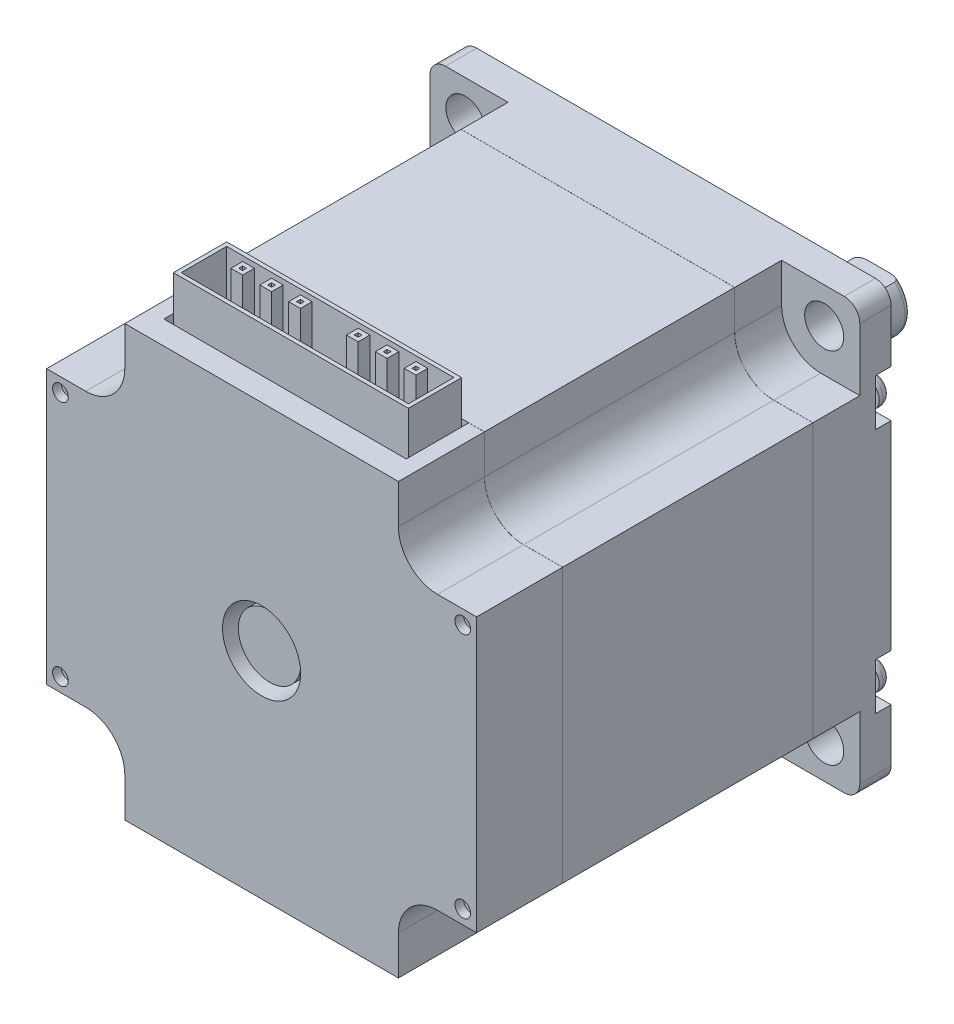
from build123d import *

# Parameters (mm, degrees)
SKETCH_1_R              = 5
SKETCH_1_R_2            = 2.5
EXTRUDE_1_DEPTH         = 4
SKETCH_2_R              = 5
EXTRUDE_2_DEPTH         = 6
SKETCH_3_R              = 5
EXTRUDE_3_DEPTH         = 32
SKETCH_4_R              = 5
EXTRUDE_4_DEPTH         = 11
EXTRUDE_5_DEPTH         = 52
EXTRUDE_5_DEPTH_BACK    = 26
SKETCH_5_R              = 4
SKETCH_6_W              = 13.056631504
SKETCH_6_H              = 3.959548569
CUT_EXTRUDE_1_DEPTH     = 18
EXTRUDE_START           = 1
SKETCH_7_R              = 19
SKETCH_7_R_2            = 5
EXTRUDE_6_DEPTH         = 1
SKETCH_8_W              = 31
SKETCH_8_H              = 8
CUT_EXTRUDE_2_DEPTH     = 5
SKETCH_9_W              = 30.064308904
SKETCH_9_H              = 6.814167658
SKETCH_9_W_2            = 29.064308904
SKETCH_9_H_2            = 5.814167658
SKETCH_9_W_3            = 1.5
SKETCH_9_H_3            = 1.5
SKETCH_9_W_4            = 0.5
SKETCH_9_H_4            = 0.5
EXTRUDE_1_2_DEPTH       = 10
SKETCH_10_R             = 1
CUT_EXTRUDE_3_DEPTH     = 60
CUT_EXTRUDE_START       = -2
SKETCH_11_R             = 1
CUT_EXTRUDE_4_DEPTH     = 2
EXTRUDE_7_DEPTH         = 0.5
EXTRUDE_7_DEPTH_BACK    = 50
SKETCH_12_R             = 0.9
EXTRUDE_7_2_DEPTH       = 0.5
EXTRUDE_7_2_DEPTH_BACK  = 50
EXTRUDE_7_3_DEPTH       = 0.5
EXTRUDE_7_3_DEPTH_BACK  = 50
EXTRUDE_7_4_DEPTH       = 0.5
EXTRUDE_7_4_DEPTH_BACK  = 50
SKETCH_13_R             = 1.75
EXTRUDE_8_DEPTH         = 1.5
FILLET_2_R              = 1
FILLET_3_R              = 1
FILLET_4_R              = 1
FILLET_5_R              = 1
CUT_EXTRUDE_START_2     = -1
CUT_EXTRUDE_1_2_DEPTH   = 1
CUT_EXTRUDE_1_2_2_DEPTH = 1
CUT_EXTRUDE_1_2_3_DEPTH = 1
CUT_EXTRUDE_1_2_4_DEPTH = 1


with BuildPart() as part:
    # Эскиз1 → Extrude 1 (new body)
    # profile 1 of 6: a face of its own
    with BuildSketch(Plane.XY):
        with BuildLine():
            ThreePointArc((-17.5, -22.5), (-18.964466094, -18.964466094), (-22.5, -17.5))
            Line((-22.5, -17.5), (-27.5, -17.5))
            Line((-27.5, -17.5), (-27.5, 17.5))
            Line((-27.5, 17.5), (-22.5, 17.5))
            ThreePointArc((-22.5, 17.5), (-18.964466094, 18.964466094), (-17.5, 22.5))
            Line((-17.5, 22.5), (-17.5, 27.5))
            Line((-17.5, 27.5), (17.5, 27.5))
            Line((17.5, 27.5), (17.5, 22.5))
            ThreePointArc((17.5, 22.5), (18.964466094, 18.964466094), (22.5, 17.5))
            Line((22.5, 17.5), (27.5, 17.5))
            Line((27.5, 17.5), (27.5, -17.5))
            Line((27.5, -17.5), (22.5, -17.5))
            ThreePointArc((22.5, -17.5), (18.964466094, -18.964466094), (17.5, -22.5))
            Line((17.5, -22.5), (17.5, -27.5))
            Line((17.5, -27.5), (-17.5, -27.5))
            Line((-17.5, -27.5), (-17.5, -22.5))
        make_face()
        Circle(SKETCH_1_R, mode=Mode.SUBTRACT)
    # profile 2 of 6: a face of its own
    with BuildSketch(Plane.XY):
        with BuildLine():
            Line((17.5, 22.5), (17.5, 27.5))
            Line((17.5, 27.5), (25.5, 27.5))
            ThreePointArc((25.5, 27.5), (26.914213562, 26.914213562), (27.5, 25.5))
            Line((27.5, 25.5), (27.5, 17.5))
            Line((27.5, 17.5), (22.5, 17.5))
            ThreePointArc((22.5, 17.5), (18.964466094, 18.964466094), (17.5, 22.5))
        make_face()
        with Locations((22.946359788, 22.946359788)):
            Circle(SKETCH_1_R_2, mode=Mode.SUBTRACT)
    # profile 3 of 6: a face of its own
    with BuildSketch(Plane.XY):
        with BuildLine():
            ThreePointArc((-25.5, 27.5), (-26.265366865, 27.347759065), (-26.914213562, 26.914213562))
            Line((-26.914213562, 26.914213562), (-24.714126741, 24.714126741))
            ThreePointArc((-24.714126741, 24.714126741), (-21.989651207, 25.256058619), (-20.446359788, 22.946359788))
            ThreePointArc((-20.446359788, 22.946359788), (-20.636660957, 21.989651207), (-21.178592835, 21.178592835))
            Line((-21.178592835, 21.178592835), (-18.964466094, 18.964466094))
            ThreePointArc((-18.964466094, 18.964466094), (-17.880602337, 20.586582838), (-17.5, 22.5))
            Line((-17.5, 22.5), (-17.5, 27.5))
            Line((-17.5, 27.5), (-25.5, 27.5))
        make_face()
    # profile 4 of 6: a face of its own
    with BuildSketch(Plane.XY):
        with BuildLine():
            ThreePointArc((-26.914213562, 26.914213562), (-27.347759065, 26.265366865), (-27.5, 25.5))
            Line((-27.5, 25.5), (-27.5, 17.5))
            Line((-27.5, 17.5), (-22.5, 17.5))
            ThreePointArc((-22.5, 17.5), (-20.586582838, 17.880602337), (-18.964466094, 18.964466094))
            Line((-18.964466094, 18.964466094), (-21.178592835, 21.178592835))
            ThreePointArc((-21.178592835, 21.178592835), (-24.714126741, 21.178592835), (-24.714126741, 24.714126741))
            Line((-24.714126741, 24.714126741), (-26.914213562, 26.914213562))
        make_face()
    # profile 5 of 6: a face of its own
    with BuildSketch(Plane.XY):
        with BuildLine():
            Line((-17.5, -22.5), (-17.5, -27.5))
            Line((-17.5, -27.5), (-25.5, -27.5))
            ThreePointArc((-25.5, -27.5), (-26.914213562, -26.914213562), (-27.5, -25.5))
            Line((-27.5, -25.5), (-27.5, -17.5))
            Line((-27.5, -17.5), (-22.5, -17.5))
            ThreePointArc((-22.5, -17.5), (-18.964466094, -18.964466094), (-17.5, -22.5))
        make_face()
        with Locations((-22.946359788, -22.946359788)):
            Circle(SKETCH_1_R_2, mode=Mode.SUBTRACT)
    # profile 6 of 6: a face of its own
    with BuildSketch(Plane.XY):
        with BuildLine():
            ThreePointArc((17.5, -22.5), (18.964466094, -18.964466094), (22.5, -17.5))
            Line((22.5, -17.5), (27.5, -17.5))
            Line((27.5, -17.5), (27.5, -25.5))
            ThreePointArc((27.5, -25.5), (26.914213562, -26.914213562), (25.5, -27.5))
            Line((25.5, -27.5), (17.5, -27.5))
            Line((17.5, -27.5), (17.5, -22.5))
        make_face()
        with Locations((22.946359788, -22.946359788)):
            Circle(SKETCH_1_R_2, mode=Mode.SUBTRACT)
    extrude(amount=EXTRUDE_1_DEPTH)

    # Эскиз2 → Бобышка-Вытянуть2 (add)
    with BuildSketch(Plane.XY.offset(4)):
        with BuildLine():
            ThreePointArc((-17.5, -22.5), (-18.964466094, -18.964466094), (-22.5, -17.5))
            Line((-22.5, -17.5), (-27.5, -17.5))
            Line((-27.5, -17.5), (-27.5, 17.5))
            Line((-27.5, 17.5), (-22.5, 17.5))
            ThreePointArc((-22.5, 17.5), (-18.964466094, 18.964466094), (-17.5, 22.5))
            Line((-17.5, 22.5), (-17.5, 27.5))
            Line((-17.5, 27.5), (17.5, 27.5))
            Line((17.5, 27.5), (17.5, 22.5))
            ThreePointArc((17.5, 22.5), (18.964466094, 18.964466094), (22.5, 17.5))
            Line((22.5, 17.5), (27.5, 17.5))
            Line((27.5, 17.5), (27.5, -17.5))
            Line((27.5, -17.5), (22.5, -17.5))
            ThreePointArc((22.5, -17.5), (18.964466094, -18.964466094), (17.5, -22.5))
            Line((17.5, -22.5), (17.5, -27.5))
            Line((17.5, -27.5), (-17.5, -27.5))
            Line((-17.5, -27.5), (-17.5, -22.5))
        make_face()
        Circle(SKETCH_2_R, mode=Mode.SUBTRACT)
    extrude(amount=EXTRUDE_2_DEPTH)

    # Эскиз7 → Бобышка-Вытянуть6 (add)
    with BuildSketch(Plane(origin=(0, 0, 0), x_dir=(-1, 0, 0), z_dir=(0, 0, -1)).offset(EXTRUDE_START)):
        with Locations(Location((0, 0, 0), (0, 0, 180))):
            Circle(SKETCH_7_R)
        with Locations(Location((0, 0, 0), (0, 0, 180))):
            Circle(SKETCH_7_R_2, mode=Mode.SUBTRACT)
    extrude(amount=-EXTRUDE_6_DEPTH)


with BuildPart() as body_2:
    # Эскиз3 → Бобышка-Вытянуть3 (new body)
    with BuildSketch(Plane.XY.offset(10.01)):
        with BuildLine():
            ThreePointArc((-17.5, -22.5), (-18.964466094, -18.964466094), (-22.5, -17.5))
            Line((-22.5, -17.5), (-27.5, -17.5))
            Line((-27.5, -17.5), (-27.5, 17.5))
            Line((-27.5, 17.5), (-22.5, 17.5))
            ThreePointArc((-22.5, 17.5), (-18.964466094, 18.964466094), (-17.5, 22.5))
            Line((-17.5, 22.5), (-17.5, 27.5))
            Line((-17.5, 27.5), (17.5, 27.5))
            Line((17.5, 27.5), (17.5, 22.5))
            ThreePointArc((17.5, 22.5), (18.964466094, 18.964466094), (22.5, 17.5))
            Line((22.5, 17.5), (27.5, 17.5))
            Line((27.5, 17.5), (27.5, -17.5))
            Line((27.5, -17.5), (22.5, -17.5))
            ThreePointArc((22.5, -17.5), (18.964466094, -18.964466094), (17.5, -22.5))
            Line((17.5, -22.5), (17.5, -27.5))
            Line((17.5, -27.5), (-17.5, -27.5))
            Line((-17.5, -27.5), (-17.5, -22.5))
        make_face()
        Circle(SKETCH_3_R, mode=Mode.SUBTRACT)
    extrude(amount=EXTRUDE_3_DEPTH)


with BuildPart() as body_3:
    # Эскиз4 → Бобышка-Вытянуть4 (new body)
    with BuildSketch(Plane.XY.offset(42.02)):
        with BuildLine():
            ThreePointArc((-17.5, -22.5), (-18.964466094, -18.964466094), (-22.5, -17.5))
            Line((-22.5, -17.5), (-27.5, -17.5))
            Line((-27.5, -17.5), (-27.5, 17.5))
            Line((-27.5, 17.5), (-22.5, 17.5))
            ThreePointArc((-22.5, 17.5), (-18.964466094, 18.964466094), (-17.5, 22.5))
            Line((-17.5, 22.5), (-17.5, 27.5))
            Line((-17.5, 27.5), (17.5, 27.5))
            Line((17.5, 27.5), (17.5, 22.5))
            ThreePointArc((17.5, 22.5), (18.964466094, 18.964466094), (22.5, 17.5))
            Line((22.5, 17.5), (27.5, 17.5))
            Line((27.5, 17.5), (27.5, -17.5))
            Line((27.5, -17.5), (22.5, -17.5))
            ThreePointArc((22.5, -17.5), (18.964466094, -18.964466094), (17.5, -22.5))
            Line((17.5, -22.5), (17.5, -27.5))
            Line((17.5, -27.5), (-17.5, -27.5))
            Line((-17.5, -27.5), (-17.5, -22.5))
        make_face()
        Circle(SKETCH_4_R, mode=Mode.SUBTRACT)
    extrude(amount=EXTRUDE_4_DEPTH)

    # Эскиз8 → Вырез-Вытянуть2 (cut)
    with BuildSketch(Plane(origin=(0, 27.5, 0), x_dir=(1, 0, 0), z_dir=(0, 1, 0))):
        with Locations((0, -46.02)):
            Rectangle(SKETCH_8_W, SKETCH_8_H)
    extrude(amount=-CUT_EXTRUDE_2_DEPTH, mode=Mode.SUBTRACT)

    # Эскиз9 → Extrude 1 2 (add)
    # profile 1 of 7: a face of its own
    with BuildSketch(Plane(origin=(0, 22.5, 0), x_dir=(1, 0, 0), z_dir=(0, 1, 0))):
        with Locations((0, -45.862916171)):
            Rectangle(SKETCH_9_W, SKETCH_9_H)
        with Locations((0, -45.862916171)):
            Rectangle(SKETCH_9_W_2, SKETCH_9_H_2, mode=Mode.SUBTRACT)
    # profile 2 of 7: a face of its own
    with BuildSketch(Plane(origin=(0, 22.5, 0), x_dir=(1, 0, 0), z_dir=(0, 1, 0))):
        with Locations((3.695538613, -44.360416171)):
            Rectangle(SKETCH_9_W_3, SKETCH_9_H_3)
        with Locations((3.695538613, -44.360416171)):
            Rectangle(SKETCH_9_W_4, SKETCH_9_H_4, mode=Mode.SUBTRACT)
    # profile 3 of 7: a face of its own
    with BuildSketch(Plane(origin=(0, 22.5, 0), x_dir=(1, 0, 0), z_dir=(0, 1, 0))):
        with Locations((7.391077226, -44.360416171)):
            Rectangle(SKETCH_9_W_3, SKETCH_9_H_3)
        with Locations((7.391077226, -44.360416171)):
            Rectangle(SKETCH_9_W_4, SKETCH_9_H_4, mode=Mode.SUBTRACT)
    # profile 4 of 7: a face of its own
    with BuildSketch(Plane(origin=(0, 22.5, 0), x_dir=(1, 0, 0), z_dir=(0, 1, 0))):
        with Locations((-3.695538613, -44.360416171)):
            Rectangle(SKETCH_9_W_3, SKETCH_9_H_3)
        with Locations((-3.695538613, -44.360416171)):
            Rectangle(SKETCH_9_W_4, SKETCH_9_H_4, mode=Mode.SUBTRACT)
    # profile 5 of 7: a face of its own
    with BuildSketch(Plane(origin=(0, 22.5, 0), x_dir=(1, 0, 0), z_dir=(0, 1, 0))):
        with Locations((-11.086615839, -44.360416171)):
            Rectangle(SKETCH_9_W_3, SKETCH_9_H_3)
        with Locations((-11.086615839, -44.360416171)):
            Rectangle(SKETCH_9_W_4, SKETCH_9_H_4, mode=Mode.SUBTRACT)
    # profile 6 of 7: a face of its own
    with BuildSketch(Plane(origin=(0, 22.5, 0), x_dir=(1, 0, 0), z_dir=(0, 1, 0))):
        with Locations((11.086615839, -44.360416171)):
            Rectangle(SKETCH_9_W_3, SKETCH_9_H_3)
        with Locations((11.086615839, -44.360416171)):
            Rectangle(SKETCH_9_W_4, SKETCH_9_H_4, mode=Mode.SUBTRACT)
    # profile 7 of 7: a face of its own
    with BuildSketch(Plane(origin=(0, 22.5, 0), x_dir=(1, 0, 0), z_dir=(0, 1, 0))):
        with Locations((-7.391077226, -44.360416171)):
            Rectangle(SKETCH_9_W_3, SKETCH_9_H_3)
        with Locations((-7.391077226, -44.360416171)):
            Rectangle(SKETCH_9_W_4, SKETCH_9_H_4, mode=Mode.SUBTRACT)
    extrude(amount=EXTRUDE_1_2_DEPTH)


with BuildPart() as body_4:
    # Эскиз5 → Бобышка-Вытянуть5 (new, two sides: drawn at the far end of the back side and taken through both)
    with BuildSketch(Plane.XY.offset(-EXTRUDE_5_DEPTH_BACK)):
        Circle(SKETCH_5_R)
    extrude(amount=EXTRUDE_5_DEPTH + EXTRUDE_5_DEPTH_BACK)

    # Эскиз6 → Cut-Extrude 1 (cut)
    with BuildSketch(Plane(origin=(0, 0, -26), x_dir=(-1, 0, 0), z_dir=(0, 0, -1))):
        with Locations((0, 4.979774285)):
            Rectangle(SKETCH_6_W, SKETCH_6_H)
    extrude(amount=-CUT_EXTRUDE_1_DEPTH, mode=Mode.SUBTRACT)

    # Скругление1: read off the stored shape, not the designer's step
    # Скругление1 outline → Скругление1 (revolve, cut)
    with BuildSketch(Plane.XZ):
        with BuildLine():
            ThreePointArc((4, -25.292893219), (3.792893219, -25.792893219), (3.292893219, -26))
            Line((3.292893219, -26), (4, -26))
            Line((4, -26), (4, -25.292893219))
        make_face()
    revolve(axis=Axis((0, 0, 0), (0, 0, 1)), mode=Mode.SUBTRACT)


with BuildPart() as cut_extrude_3_tool:
    # Эскиз10 → Вырез-Вытянуть3 (new body)
    with BuildSketch(Plane.XY.offset(53.02)):
        with Locations((-25.732233047, 15.732233047)):
            Circle(SKETCH_10_R)
        with Locations((25.732233047, 15.732233047)):
            Circle(SKETCH_10_R)
        with Locations((-25.732233047, -15.732233047)):
            Circle(SKETCH_10_R)
        with Locations((25.732233047, -15.732233047)):
            Circle(SKETCH_10_R)
    extrude(amount=-CUT_EXTRUDE_3_DEPTH)


with BuildPart() as part_1:
    add(part.part)

    # Вырез-Вытянуть3: cut by cut_extrude_3_tool
    add(cut_extrude_3_tool.part, mode=Mode.SUBTRACT)

    # Эскиз11 → Вырез-Вытянуть4 (cut)
    # profile 1 of 4: a face of its own
    with BuildSketch(Plane(origin=(0, 0, 0), x_dir=(-1, 0, 0), z_dir=(0, 0, -1)).offset(CUT_EXTRUDE_START)):
        with BuildLine():
            Line((-27.5, 18.732233047), (-27.5, 12.732233047))
            Line((-27.5, 12.732233047), (-25.732233047, 12.732233047))
            ThreePointArc((-25.732233047, 12.732233047), (-22.732233047, 15.732233047), (-25.732233047, 18.732233047))
            Line((-25.732233047, 18.732233047), (-27.5, 18.732233047))
        make_face()
        with Locations(Location((-25.732233047, 15.732233047, 0), (0, 0, 180))):
            Circle(SKETCH_11_R, mode=Mode.SUBTRACT)
    # profile 2 of 4: a face of its own
    with BuildSketch(Plane(origin=(0, 0, 0), x_dir=(-1, 0, 0), z_dir=(0, 0, -1)).offset(CUT_EXTRUDE_START)):
        with BuildLine():
            Line((-25.732233047, -12.732233047), (-27.5, -12.732233047))
            Line((-27.5, -12.732233047), (-27.5, -18.732233047))
            Line((-27.5, -18.732233047), (-25.732233047, -18.732233047))
            ThreePointArc((-25.732233047, -18.732233047), (-22.732233047, -15.732233047), (-25.732233047, -12.732233047))
        make_face()
        with Locations(Location((-25.732233047, -15.732233047, 0), (0, 0, 180))):
            Circle(SKETCH_11_R, mode=Mode.SUBTRACT)
    # profile 3 of 4: a face of its own
    with BuildSketch(Plane(origin=(0, 0, 0), x_dir=(-1, 0, 0), z_dir=(0, 0, -1)).offset(CUT_EXTRUDE_START)):
        with BuildLine():
            Line((27.5, 18.732233047), (25.732233047, 18.732233047))
            ThreePointArc((25.732233047, 18.732233047), (22.732233047, 15.732233047), (25.732233047, 12.732233047))
            Line((25.732233047, 12.732233047), (27.5, 12.732233047))
            Line((27.5, 12.732233047), (27.5, 18.732233047))
        make_face()
        with Locations(Location((25.732233047, 15.732233047, 0), (0, 0, 180))):
            Circle(SKETCH_11_R, mode=Mode.SUBTRACT)
    # profile 4 of 4: a face of its own
    with BuildSketch(Plane(origin=(0, 0, 0), x_dir=(-1, 0, 0), z_dir=(0, 0, -1)).offset(CUT_EXTRUDE_START)):
        with BuildLine():
            Line((27.5, -12.732233047), (25.732233047, -12.732233047))
            ThreePointArc((25.732233047, -12.732233047), (22.732233047, -15.732233047), (25.732233047, -18.732233047))
            Line((25.732233047, -18.732233047), (27.5, -18.732233047))
            Line((27.5, -18.732233047), (27.5, -12.732233047))
        make_face()
        with Locations(Location((25.732233047, -15.732233047, 0), (0, 0, 180))):
            Circle(SKETCH_11_R, mode=Mode.SUBTRACT)
    extrude(amount=CUT_EXTRUDE_4_DEPTH, mode=Mode.SUBTRACT)


with BuildPart() as body_2_1:
    add(body_2.part)

    # Вырез-Вытянуть3: cut by cut_extrude_3_tool
    add(cut_extrude_3_tool.part, mode=Mode.SUBTRACT)


with BuildPart() as body_3_1:
    add(body_3.part)

    # Вырез-Вытянуть3: cut by cut_extrude_3_tool
    add(cut_extrude_3_tool.part, mode=Mode.SUBTRACT)


with BuildPart() as body_5:
    # Эскиз12 → Бобышка-Вытянуть7 (new, two sides: drawn at the far end of the back side and taken through both)
    with BuildSketch(Plane(origin=(0, 0, 2), x_dir=(-1, 0, 0), z_dir=(0, 0, -1)).offset(-EXTRUDE_7_DEPTH_BACK)):
        with Locations((-25.732233047, 15.732233047)):
            Circle(SKETCH_12_R)
    extrude(amount=EXTRUDE_7_DEPTH + EXTRUDE_7_DEPTH_BACK)



with BuildPart() as body_6:
    # Эскиз12 → Extrude 7 2 (new, two sides: drawn at the far end of the back side and taken through both)
    with BuildSketch(Plane(origin=(0, 0, 2), x_dir=(-1, 0, 0), z_dir=(0, 0, -1)).offset(-EXTRUDE_7_2_DEPTH_BACK)):
        with Locations(Location((25.732233047, 15.732233047, 0), (0, 0, 180))):
            Circle(SKETCH_12_R)
    extrude(amount=EXTRUDE_7_2_DEPTH + EXTRUDE_7_2_DEPTH_BACK)


with BuildPart() as body_7:
    # Эскиз12 → Extrude 7 3 (new, two sides: drawn at the far end of the back side and taken through both)
    with BuildSketch(Plane(origin=(0, 0, 2), x_dir=(-1, 0, 0), z_dir=(0, 0, -1)).offset(-EXTRUDE_7_3_DEPTH_BACK)):
        with Locations((25.732233047, -15.732233047)):
            Circle(SKETCH_12_R)
    extrude(amount=EXTRUDE_7_3_DEPTH + EXTRUDE_7_3_DEPTH_BACK)


with BuildPart() as body_8:
    # Эскиз12 → Extrude 7 4 (new, two sides: drawn at the far end of the back side and taken through both)
    with BuildSketch(Plane(origin=(0, 0, 2), x_dir=(-1, 0, 0), z_dir=(0, 0, -1)).offset(-EXTRUDE_7_4_DEPTH_BACK)):
        with Locations(Location((-25.732233047, -15.732233047, 0), (0, 0, 180))):
            Circle(SKETCH_12_R)
    extrude(amount=EXTRUDE_7_4_DEPTH + EXTRUDE_7_4_DEPTH_BACK)


with BuildPart() as body_5_1:
    add(body_5.part)

    add(body_6.part)  # Бобышка-Вытянуть8 merges body 6

    add(body_7.part)  # Бобышка-Вытянуть8 merges body 7

    add(body_8.part)  # Бобышка-Вытянуть8 merges body 8
    # Эскиз13 → Бобышка-Вытянуть8 (add)
    with BuildSketch(Plane(origin=(0, 0, 1.5), x_dir=(-1, 0, 0), z_dir=(0, 0, -1))):
        with Locations((-25.732233047, 15.732233047)):
            Circle(SKETCH_13_R)
        with Locations(Location((25.732233047, 15.732233047, 0), (0, 0, 180))):
            Circle(SKETCH_13_R)
        with Locations((25.732233047, -15.732233047)):
            Circle(SKETCH_13_R)
        with Locations(Location((-25.732233047, -15.732233047, 0), (0, 0, 180))):
            Circle(SKETCH_13_R)
    extrude(amount=EXTRUDE_8_DEPTH)

    # Скругление2
    fillet_2_edges = [body_5_1.edges().sort_by_distance(p)[0] for p in [
        (27.482233047, 15.732233047, 0),
    ]]
    fillet(fillet_2_edges, radius=FILLET_2_R)

    # Скругление3
    fillet_3_edges = [body_5_1.edges().sort_by_distance(p)[0] for p in [
        (-27.482233047, 15.732233047, 0),
    ]]
    fillet(fillet_3_edges, radius=FILLET_3_R)

    # Скругление4
    fillet_4_edges = [body_5_1.edges().sort_by_distance(p)[0] for p in [
        (-23.982233047, -15.732233047, 0),
    ]]
    fillet(fillet_4_edges, radius=FILLET_4_R)

    # Скругление5
    fillet_5_edges = [body_5_1.edges().sort_by_distance(p)[0] for p in [
        (23.982233047, -15.732233047, 0),
    ]]
    fillet(fillet_5_edges, radius=FILLET_5_R)

    # Cut-Extrude 1 2: read off the stored shape, not the designer's step
    # Cut-Extrude 1 2 outline → Cut-Extrude 1 2 (cut)
    with BuildSketch(Plane(origin=(0, 0, 0), x_dir=(-1, 0, 0), z_dir=(0, 0, -1)).offset(CUT_EXTRUDE_START_2)):
        Polygon((-24.732233047, -15.482233047), (-25.482233047, -15.482233047), (-25.482233047, -14.732233047), (-25.982233047, -14.732233047), (-25.982233047, -15.482233047), (-26.732233047, -15.482233047), (-26.732233047, -15.982233047), (-25.982233047, -15.982233047), (-25.982233047, -16.732233047), (-25.482233047, -16.732233047), (-25.482233047, -15.982233047), (-24.732233047, -15.982233047), align=None)
    extrude(amount=CUT_EXTRUDE_1_2_DEPTH, mode=Mode.SUBTRACT)

    # Cut-Extrude 1 2 2 outline → Cut-Extrude 1 2 2 (cut)
    with BuildSketch(Plane(origin=(0, 0, 0), x_dir=(-1, 0, 0), z_dir=(0, 0, -1)).offset(CUT_EXTRUDE_START_2)):
        Polygon((26.732233047, -15.482233047), (25.982233047, -15.482233047), (25.982233047, -14.732233047), (25.482233047, -14.732233047), (25.482233047, -15.482233047), (24.732233047, -15.482233047), (24.732233047, -15.982233047), (25.482233047, -15.982233047), (25.482233047, -16.732233047), (25.982233047, -16.732233047), (25.982233047, -15.982233047), (26.732233047, -15.982233047), align=None)
    extrude(amount=CUT_EXTRUDE_1_2_2_DEPTH, mode=Mode.SUBTRACT)

    # Cut-Extrude 1 2 3 outline → Cut-Extrude 1 2 3 (cut)
    with BuildSketch(Plane(origin=(0, 0, 0), x_dir=(-1, 0, 0), z_dir=(0, 0, -1)).offset(CUT_EXTRUDE_START_2)):
        Polygon((25.482233047, 16.732233047), (25.482233047, 15.982233047), (24.732233047, 15.982233047), (24.732233047, 15.482233047), (25.482233047, 15.482233047), (25.482233047, 14.732233047), (25.982233047, 14.732233047), (25.982233047, 15.482233047), (26.732233047, 15.482233047), (26.732233047, 15.982233047), (25.982233047, 15.982233047), (25.982233047, 16.732233047), align=None)
    extrude(amount=CUT_EXTRUDE_1_2_3_DEPTH, mode=Mode.SUBTRACT)

    # Cut-Extrude 1 2 4 outline → Cut-Extrude 1 2 4 (cut)
    with BuildSketch(Plane(origin=(0, 0, 0), x_dir=(-1, 0, 0), z_dir=(0, 0, -1)).offset(CUT_EXTRUDE_START_2)):
        Polygon((-24.732233047, 15.982233047), (-25.482233047, 15.982233047), (-25.482233047, 16.732233047), (-25.982233047, 16.732233047), (-25.982233047, 15.982233047), (-26.732233047, 15.982233047), (-26.732233047, 15.482233047), (-25.982233047, 15.482233047), (-25.982233047, 14.732233047), (-25.482233047, 14.732233047), (-25.482233047, 15.482233047), (-24.732233047, 15.482233047), align=None)
    extrude(amount=CUT_EXTRUDE_1_2_4_DEPTH, mode=Mode.SUBTRACT)


solid = Compound([body_4.part, part_1.part, body_2_1.part, body_3_1.part, body_5_1.part])
